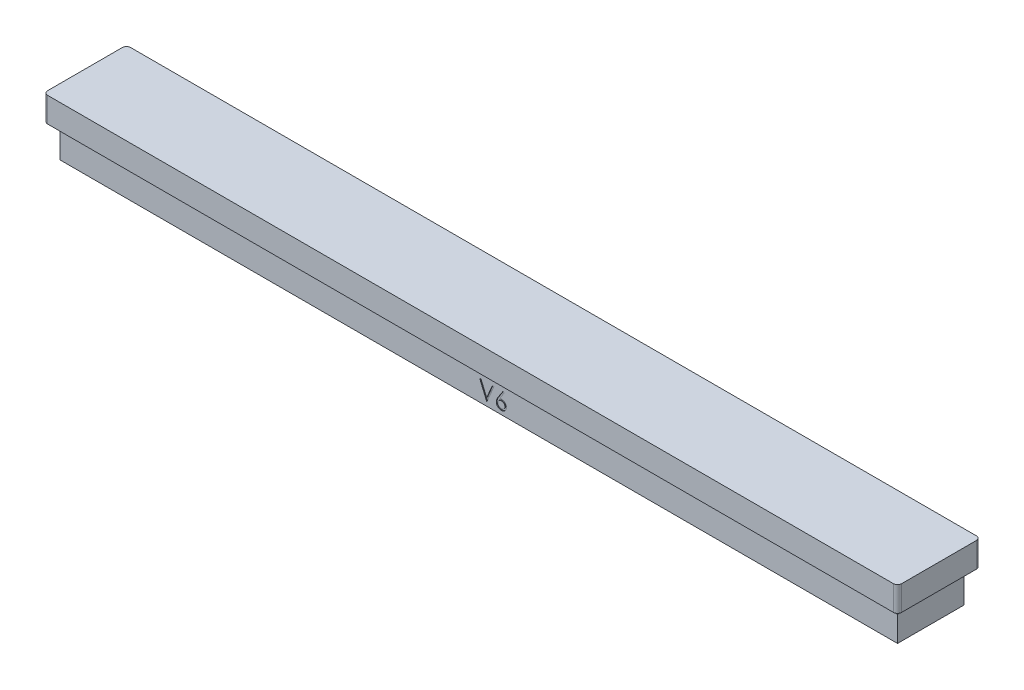
from build123d import *

# Parameters (mm, degrees)
SKETCH1_W           = 101
SKETCH1_H           = 8
SKETCH1_W_2         = 99
SKETCH1_H_2         = 6
BOSS_EXTRUDE1_DEPTH = 10
SKETCH3_W           = 103
SKETCH3_H           = 10
SKETCH3_W_2         = 101
SKETCH3_H_2         = 8
BOSS_EXTRUDE3_DEPTH = 6
FILLET4_R           = 1
FILLET5_R           = 1
FILLET6_R           = 1
FILLET7_R           = 1
FILLET9_R           = 0.5
CUT_EXTRUDE1_DEPTH  = 4
CUT_EXTRUDE2_DEPTH  = 0.1
BOSS_EXTRUDE4_START = 1
BOSS_EXTRUDE4_DEPTH = 1
SKETCH9_W           = 3
SKETCH9_H           = 5
BOSS_EXTRUDE6_DEPTH = 1.2


# Some blends are built 0.0001 mm under size
with BuildPart() as part:
    # Sketch1 → Boss-Extrude1 (new body)
    with BuildSketch(Plane(origin=(0, 0, 0), x_dir=(1, 0, 0), z_dir=(0, 1, 0))):
        Rectangle(SKETCH1_W, SKETCH1_H)
        Rectangle(SKETCH1_W_2, SKETCH1_H_2, mode=Mode.SUBTRACT)
    extrude(amount=BOSS_EXTRUDE1_DEPTH)

    # Sketch3 → Boss-Extrude3 (add)
    with BuildSketch(Plane(origin=(0, 10, 0), x_dir=(1, 0, 0), z_dir=(0, 1, 0))):
        Rectangle(SKETCH3_W, SKETCH3_H)
        Rectangle(SKETCH3_W_2, SKETCH3_H_2, mode=Mode.SUBTRACT)
    extrude(amount=-BOSS_EXTRUDE3_DEPTH)

    # Fillet4
    fillet4_edges = [part.edges().sort_by_distance(p)[0] for p in [
        (0, 4, -4),
    ]]
    fillet(fillet4_edges, radius=FILLET4_R - 0.0001)  # a hair under: the kernel refuses the full size

    # Fillet5
    fillet5_edges = [part.edges().sort_by_distance(p)[0] for p in [
        (0, 4, 4),
    ]]
    fillet(fillet5_edges, radius=FILLET5_R - 0.0001)  # a hair under: the kernel refuses the full size

    # Fillet6
    fillet6_edges = [part.edges().sort_by_distance(p)[0] for p in [
        (50.5, 4, 0),
    ]]
    fillet(fillet6_edges, radius=FILLET6_R - 0.0001)  # a hair under: the kernel refuses the full size

    # Fillet7
    fillet7_edges = [part.edges().sort_by_distance(p)[0] for p in [
        (-50.5, 4, 0),
    ]]
    fillet(fillet7_edges, radius=FILLET7_R - 0.0001)  # a hair under: the kernel refuses the full size

    # Fillet9
    # the kernel refuses this fillet: 0.5 mm, written as the material it takes off along each edge
    with BuildSketch(Plane(origin=(51.5, 11.25, -5), x_dir=(0, 0, 1), z_dir=(0, -1, 0))) as fillet9_piece_1:
        with BuildLine():
            CenterArc((FILLET9_R, FILLET9_R), FILLET9_R, 180, 90)
            Line((0, FILLET9_R), (0, 0))
            Line((0, 0), (FILLET9_R, 0))
        make_face()
    extrude(amount=8.5, mode=Mode.SUBTRACT)
    with BuildSketch(Plane(origin=(51.5, 11.25, 5), x_dir=(0, 0, -1), z_dir=(0, -1, 0)), Plane(origin=(-51.5, 11.25, 5), x_dir=(1, 0, 0), z_dir=(0, -1, 0)), Plane(origin=(-51.5, 11.25, -5), x_dir=(0, 0, 1), z_dir=(0, -1, 0))) as fillet9_piece_2:
        with BuildLine():
            CenterArc((FILLET9_R, -FILLET9_R), FILLET9_R, 90, 90)
            Line((0, -FILLET9_R), (0, 0))
            Line((0, 0), (FILLET9_R, 0))
        make_face()
    extrude(amount=8.5, mode=Mode.SUBTRACT)

    # Sketch4 → Cut-Extrude1 (cut)
    with BuildSketch(Plane(origin=(0, 10, 0), x_dir=(1, 0, 0), z_dir=(0, 1, 0))):
        with BuildLine():
            Line((51.5, -4.5), (51.5, 4.5))
            ThreePointArc((51.5, 4.5), (51.353553391, 4.853553391), (51, 5))
            Line((51, 5), (-51, 5))
            ThreePointArc((-51, 5), (-51.353553391, 4.853553391), (-51.5, 4.5))
            Line((-51.5, 4.5), (-51.5, -4.5))
            ThreePointArc((-51.5, -4.5), (-51.353553391, -4.853553391), (-51, -5))
            Line((-51, -5), (51, -5))
            ThreePointArc((51, -5), (51.353553391, -4.853553391), (51.5, -4.5))
        make_face()
    extrude(amount=-CUT_EXTRUDE1_DEPTH, mode=Mode.SUBTRACT)

    # Sketch5 → Cut-Extrude2 (cut)
    # profile 1 of 2: a face of its own
    with BuildSketch(Plane.XY.offset(4)):
        Polygon((0.102564103, 2.5), (0.294871795, 2.5), (0.961538462, 0.923878205), (1.628205128, 2.5), (1.820512821, 2.5), (0.974358974, 0.5), (0.948717949, 0.5), align=None)
    # profile 2 of 2: a face of its own
    with BuildSketch(Plane.XY.offset(4)):
        with BuildLine():
            Line((2.923076923, 2.551282051), (3.061298077, 2.442708333))
            Line((3.061298077, 2.442708333), (2.532852564, 1.634615385))
            add(Edge.make_bspline(
                [(2.532852564, 1.634615385), (2.56803558, 1.640223305), (2.636664029, 1.651162188), (2.706130257, 1.652966728), (2.739983974, 1.653846154)],
                knots=[0, 0, 0, 0, 1.025318673, 2, 2, 2, 2], degree=3))
            add(Edge.make_bspline(
                [(2.739983974, 1.653846154), (2.760311115, 1.653299804), (2.800324487, 1.652224331), (2.859071231, 1.643947845), (2.915522051, 1.630904924), (2.969442973, 1.611892207), (3.021027534, 1.587605147), (3.07057176, 1.558497221), (3.117144337, 1.523065404), (3.161345011, 1.483485429), (3.201474781, 1.439647152), (3.237003956, 1.393132103), (3.266847837, 1.343988742), (3.291061506, 1.292241962), (3.309864294, 1.237971527), (3.32357152, 1.181246876), (3.331674144, 1.122028893), (3.332774425, 1.08175565), (3.333333333, 1.061298077)],
                knots=[0, 0, 0, 0, 1.04369286, 2.054478336, 3.041073146, 4.015093852, 4.984733326, 5.965804835, 6.960378782, 7.985147595, 9.009457201, 10.008161701, 10.986880575, 11.956520048, 12.937015923, 13.931873656, 14.949455224, 16, 16, 16, 16], degree=3))
            add(Edge.make_bspline(
                [(3.333333333, 1.061298077), (3.332520131, 1.033309675), (3.33091994, 0.978235123), (3.314974914, 0.898019862), (3.290197974, 0.821601282), (3.254782243, 0.750199469), (3.21079231, 0.683912287), (3.157147971, 0.625177735), (3.095751692, 0.572794857), (3.026330665, 0.528991074), (2.9516204, 0.493217902), (2.873133544, 0.467523478), (2.791632317, 0.451704353), (2.736315399, 0.449721151), (2.708333333, 0.448717949)],
                knots=[0, 0, 0, 0, 1.031375318, 2.029502543, 3.004789286, 3.987476834, 4.960371455, 5.9300674, 6.912260825, 7.929083631, 8.949397511, 9.960523116, 10.96833055, 12, 12, 12, 12], degree=3))
            add(Edge.make_bspline(
                [(2.708333333, 0.448717949), (2.681420933, 0.449591209), (2.62811218, 0.451320985), (2.54969344, 0.466730093), (2.474343145, 0.49170558), (2.402589213, 0.526113739), (2.336120291, 0.569575386), (2.276654213, 0.621896689), (2.224487485, 0.68195924), (2.181073416, 0.749753724), (2.146639855, 0.822605129), (2.12081704, 0.898569218), (2.105733473, 0.977369208), (2.103625726, 1.030787001), (2.102564103, 1.057692308)],
                knots=[0, 0, 0, 0, 1.012016664, 2.004627821, 2.994792927, 3.992885782, 4.990978636, 5.973936114, 6.964471063, 7.975201453, 8.993600317, 9.990122807, 10.98767138, 12, 12, 12, 12], degree=3))
            add(Edge.make_bspline(
                [(2.102564103, 1.057692308), (2.103239214, 1.078289212), (2.104617663, 1.120344156), (2.114242457, 1.184037887), (2.129708054, 1.249209933), (2.147028195, 1.304498044), (2.165328543, 1.349790342), (2.180558566, 1.386306623), (2.199515135, 1.423884379), (2.219728496, 1.463812171), (2.243018135, 1.505060989), (2.268341363, 1.548320229), (2.296398307, 1.592901902), (2.316066971, 1.623155728), (2.326121795, 1.638621795)],
                knots=[0, 0, 0, 0, 1.173818275, 2.396712641, 3.66331629, 4.989737886, 5.693666774, 6.447286557, 7.243889047, 8.091586357, 8.998013824, 9.943181721, 10.948533338, 12, 12, 12, 12], degree=3))
            Line((2.326121795, 1.638621795), (2.923076923, 2.551282051))
        make_face()
        with BuildLine():
            add(Edge.make_bspline(
                [(2.702323718, 1.448717949), (2.687088149, 1.448273352), (2.657328658, 1.447404926), (2.613667279, 1.442361925), (2.572345421, 1.432865316), (2.53281563, 1.42077027), (2.495816943, 1.40413995), (2.461080463, 1.383938922), (2.428471862, 1.360155391), (2.398332689, 1.333126299), (2.371007167, 1.303533138), (2.347475092, 1.271836268), (2.327176578, 1.23879958), (2.310672682, 1.204147042), (2.29782121, 1.167891899), (2.288525066, 1.1302009), (2.283351494, 1.090821296), (2.282490791, 1.064117009), (2.282051282, 1.050480769)],
                knots=[0, 0, 0, 0, 1.129588631, 2.206414736, 3.251139165, 4.268635594, 5.265702196, 6.250456724, 7.242448911, 8.251968645, 9.246821453, 10.222880186, 11.173611482, 12.116736599, 13.062300278, 14.020270554, 14.989073742, 16, 16, 16, 16], degree=3))
            add(Edge.make_bspline(
                [(2.282051282, 1.050480769), (2.282409203, 1.036966495), (2.283111032, 1.010467015), (2.289483787, 0.971416055), (2.299218119, 0.933836108), (2.313698346, 0.897920908), (2.330970853, 0.863123012), (2.353773895, 0.830702849), (2.37904063, 0.798691381), (2.409242878, 0.769547683), (2.441656228, 0.742429612), (2.476285487, 0.71872661), (2.512376892, 0.698448796), (2.550417705, 0.682556741), (2.58986821, 0.669514291), (2.631057098, 0.660336303), (2.674013016, 0.655147431), (2.703111266, 0.654285606), (2.717948718, 0.653846154)],
                knots=[0, 0, 0, 0, 0.989467248, 1.94019797, 2.891935182, 3.827694429, 4.772920941, 5.730924762, 6.725747692, 7.756678648, 8.79901574, 9.819492441, 10.826891316, 11.826466727, 12.835195252, 13.867842842, 14.912794438, 16, 16, 16, 16], degree=3))
            add(Edge.make_bspline(
                [(2.717948718, 0.653846154), (2.732786146, 0.65428564), (2.761884348, 0.655147533), (2.804840611, 0.660335915), (2.846028222, 0.669515714), (2.88548337, 0.682551583), (2.923507045, 0.698467931), (2.959566885, 0.718600456), (2.993868653, 0.742575381), (3.026303282, 0.76950134), (3.056379818, 0.798857255), (3.082252548, 0.830417097), (3.104357253, 0.863385037), (3.122319646, 0.897783831), (3.136640384, 0.933857824), (3.146424079, 0.971410238), (3.152783673, 1.010468538), (3.153487311, 1.036967009), (3.153846154, 1.050480769)],
                knots=[0, 0, 0, 0, 1.087397944, 2.132534446, 3.165364764, 4.174271784, 5.174024072, 6.181601208, 7.194203697, 8.236725232, 9.267838612, 10.269026844, 11.221737037, 12.171628256, 13.107553087, 14.05945871, 15.010357665, 16, 16, 16, 16], degree=3))
            add(Edge.make_bspline(
                [(3.153846154, 1.050480769), (3.153531701, 1.064134798), (3.152914531, 1.090933217), (3.145933989, 1.130183284), (3.136252633, 1.168083402), (3.121633758, 1.204395373), (3.102641447, 1.238975903), (3.079508072, 1.271999675), (3.052746603, 1.303719873), (3.021833723, 1.333184335), (2.988182161, 1.360125523), (2.952401826, 1.383908126), (2.914968698, 1.403979542), (2.875920731, 1.420726457), (2.834810513, 1.432811871), (2.792301747, 1.44232801), (2.747850752, 1.44739202), (2.71769269, 1.448270343), (2.702323718, 1.448717949)],
                knots=[0, 0, 0, 0, 0.978206639, 1.919901502, 2.851605144, 3.780102724, 4.718870031, 5.675451981, 6.667674623, 7.690630536, 8.733308323, 9.756129687, 10.767539656, 11.776269907, 12.797430371, 13.836405707, 14.897401972, 16, 16, 16, 16], degree=3))
        make_face(mode=Mode.SUBTRACT)
    extrude(amount=-CUT_EXTRUDE2_DEPTH, mode=Mode.SUBTRACT)

    # Sketch7 → Boss-Extrude4 (add)
    with BuildSketch(Plane(origin=(0, 6, 0), x_dir=(1, 0, 0), z_dir=(0, 1, 0)).offset(BOSS_EXTRUDE4_START)):
        with BuildLine():
            Line((51.5, -4.5), (51.5, 4.5))
            ThreePointArc((51.5, 4.5), (51.353553391, 4.853553391), (51, 5))
            Line((51, 5), (-51, 5))
            ThreePointArc((-51, 5), (-51.353553391, 4.853553391), (-51.5, 4.5))
            Line((-51.5, 4.5), (-51.5, -4.5))
            ThreePointArc((-51.5, -4.5), (-51.353553391, -4.853553391), (-51, -5))
            Line((-51, -5), (51, -5))
            ThreePointArc((51, -5), (51.353553391, -4.853553391), (51.5, -4.5))
        make_face()
    extrude(amount=-BOSS_EXTRUDE4_DEPTH)

    # Sketch9 → Boss-Extrude6 (add)
    with BuildSketch(Plane.XZ.offset(-6)):
        with Locations((-45, 0)):
            Rectangle(SKETCH9_W, SKETCH9_H)
        with Locations((-39, 0)):
            Rectangle(SKETCH9_W, SKETCH9_H)
        with Locations((-33, 0)):
            Rectangle(SKETCH9_W, SKETCH9_H)
        with Locations((-27, 0)):
            Rectangle(SKETCH9_W, SKETCH9_H)
        with Locations((-21, 0)):
            Rectangle(SKETCH9_W, SKETCH9_H)
        with Locations((-15, 0)):
            Rectangle(SKETCH9_W, SKETCH9_H)
        with Locations((-9, 0)):
            Rectangle(SKETCH9_W, SKETCH9_H)
        with Locations((-3, 0)):
            Rectangle(SKETCH9_W, SKETCH9_H)
        with Locations((3, 0)):
            Rectangle(SKETCH9_W, SKETCH9_H)
        with Locations((9, 0)):
            Rectangle(SKETCH9_W, SKETCH9_H)
        with Locations((15, 0)):
            Rectangle(SKETCH9_W, SKETCH9_H)
        with Locations((21, 0)):
            Rectangle(SKETCH9_W, SKETCH9_H)
        with Locations((27, 0)):
            Rectangle(SKETCH9_W, SKETCH9_H)
        with Locations((33, 0)):
            Rectangle(SKETCH9_W, SKETCH9_H)
        with Locations((39, 0)):
            Rectangle(SKETCH9_W, SKETCH9_H)
        with Locations((45, 0)):
            Rectangle(SKETCH9_W, SKETCH9_H)
    extrude(amount=BOSS_EXTRUDE6_DEPTH)


solid = part.part
